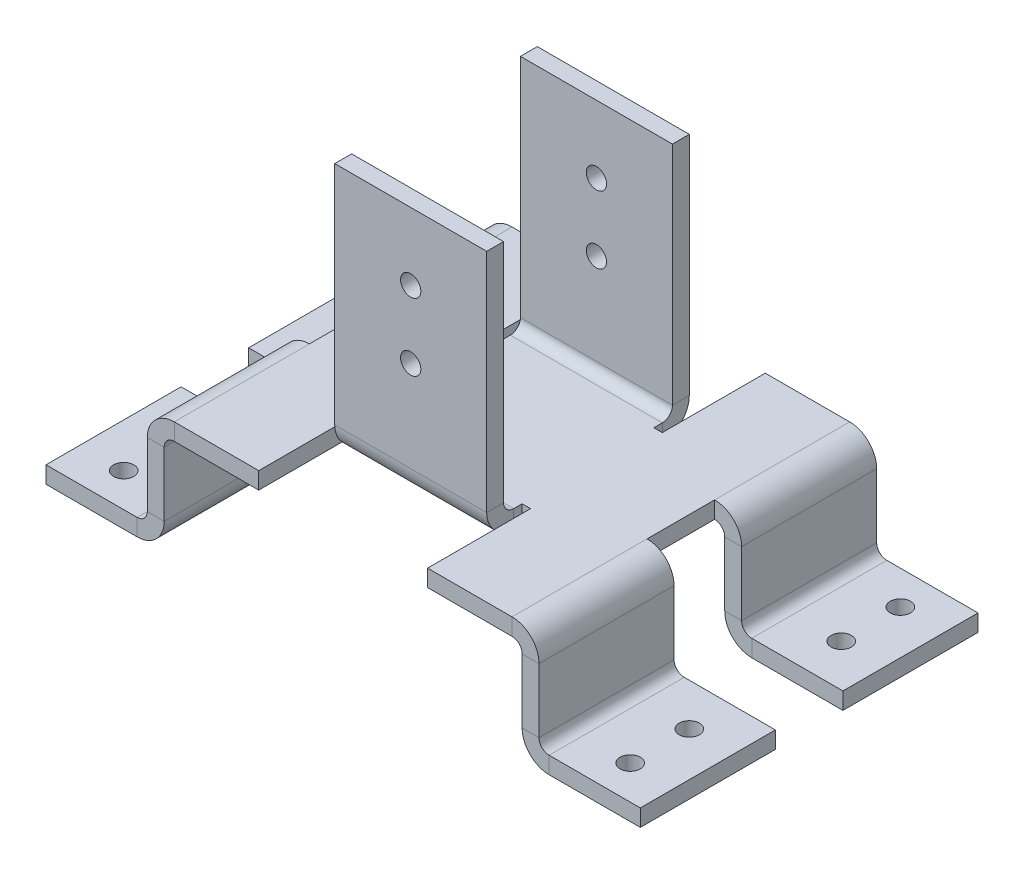
from build123d import *

# Parameters (mm, degrees)
SM_BASE_FLANGE_1_DEPTH            = 5
SM_EDGE_FLANGE_1_STRIP_W          = 26
SM_EDGE_FLANGE_1_STRIP_H          = 5
SM_EDGE_FLANGE_1_STRIP_CUT_DEPTH  = 45
SM_EDGE_FLANGE_1_RELIEF_W         = 28.5
SM_EDGE_FLANGE_1_RELIEF_H         = 2.5
SM_EDGE_FLANGE_1_RELIEF_CUT_DEPTH = 5
SM_EDGE_FLANGE_1_DEPTH            = 45
SM_EDGE_FLANGE_2_STRIP_W          = 26
SM_EDGE_FLANGE_2_STRIP_H          = 5
SM_EDGE_FLANGE_2_STRIP_CUT_DEPTH  = 45
SM_EDGE_FLANGE_2_RELIEF_W         = 28.5
SM_EDGE_FLANGE_2_RELIEF_H         = 2.5
SM_EDGE_FLANGE_2_RELIEF_CUT_DEPTH = 5
SM_EDGE_FLANGE_2_DEPTH            = 45
SM_EDGE_FLANGE_14_DEPTH           = 40
SM_EDGE_FLANGE_15_DEPTH           = 40
SM_EDGE_FLANGE_16_DEPTH           = 40
SM_EDGE_FLANGE_17_DEPTH           = 40
SM_EDGE_FLANGE_18_STRIP_W         = 26
SM_EDGE_FLANGE_18_STRIP_H         = 5
SM_EDGE_FLANGE_18_STRIP_CUT_DEPTH = 40
SM_EDGE_FLANGE_18_DEPTH           = 40
SM_EDGE_FLANGE_19_STRIP_W         = 26
SM_EDGE_FLANGE_19_STRIP_H         = 5
SM_EDGE_FLANGE_19_STRIP_CUT_DEPTH = 40
SM_EDGE_FLANGE_19_DEPTH           = 40
SM_EDGE_FLANGE_20_STRIP_W         = 26
SM_EDGE_FLANGE_20_STRIP_H         = 5
SM_EDGE_FLANGE_20_STRIP_CUT_DEPTH = 40
SM_EDGE_FLANGE_20_DEPTH           = 40
SM_EDGE_FLANGE_21_STRIP_W         = 26
SM_EDGE_FLANGE_21_STRIP_H         = 5
SM_EDGE_FLANGE_21_STRIP_CUT_DEPTH = 40
SM_EDGE_FLANGE_21_DEPTH           = 40
CUT_EXTRUDE_START                 = -35
SKETCH_80_R                       = 3
CUT_EXTRUDE_1_DEPTH               = 5
CUT_EXTRUDE_3_DEPTH               = 124.060960503
CUT_EXTRUDE_3_DEPTH_BACK          = 124.060960503
SKETCH_83_R                       = 3
CUT_EXTRUDE_START_2               = -30
SKETCH_84_R                       = 3
CUT_EXTRUDE_5_DEPTH               = 5


# Sheet-metal steps are written as plain solids
with BuildPart() as part:
    # Sketch 1 → 基体-法兰1 (new body)
    with BuildSketch(Plane(origin=(0, 0, 0), x_dir=(1, 0, 0), z_dir=(0, 1, 0))):
        Polygon((-25, -25), (-25, -50), (-50, -50), (-50, 50), (-25, 50), (-25, 25), (25, 25), (25, 50), (50, 50), (50, -50), (25, -50), (25, -25), align=None)
    extrude(amount=-SM_BASE_FLANGE_1_DEPTH)

    # 边线-法兰1 strip (across the edge) → 边线-法兰1 strip cut (cut)
    with BuildSketch(Plane(origin=(22.5, 0, -25), x_dir=(0, 0, 1), z_dir=(-1, 0, 0))):
        with Locations((-10, -2.5)):
            Rectangle(SM_EDGE_FLANGE_1_STRIP_W, SM_EDGE_FLANGE_1_STRIP_H)
    extrude(amount=SM_EDGE_FLANGE_1_STRIP_CUT_DEPTH, mode=Mode.SUBTRACT)

    # 边线-法兰1 relief (on the sheet) → 边线-法兰1 relief cut (cut)
    with BuildSketch(Plane(origin=(22.5, 0, -22), x_dir=(0, 0, 1), z_dir=(0, 1, 0))):
        with Locations((-11.75, 1.25)):
            Rectangle(SM_EDGE_FLANGE_1_RELIEF_W, SM_EDGE_FLANGE_1_RELIEF_H)
        with Locations((-11.75, -46.25)):
            Rectangle(SM_EDGE_FLANGE_1_RELIEF_W, SM_EDGE_FLANGE_1_RELIEF_H)
    extrude(amount=-SM_EDGE_FLANGE_1_RELIEF_CUT_DEPTH, mode=Mode.SUBTRACT)

    # 边线-法兰1 section (across the edge) → 边线-法兰1 (add)
    with BuildSketch(Plane(origin=(22.5, 0, -25), x_dir=(0, 0, 1), z_dir=(-1, 0, 0))):
        with BuildLine():
            Line((-5, 3), (-5, 70))
            Line((-5, 70), (0, 70))
            Line((0, 70), (0, 3))
            ThreePointArc((0, 3), (0.878679656, 0.878679656), (3, 0))
            Line((3, 0), (3, -5))
            ThreePointArc((3, -5), (-2.656854249, -2.656854249), (-5, 3))
        make_face()
    extrude(amount=SM_EDGE_FLANGE_1_DEPTH)

    # 边线-法兰2 strip (across the edge) → 边线-法兰2 strip cut (cut)
    with BuildSketch(Plane(origin=(-22.5, 0, 25), x_dir=(0, 0, -1), z_dir=(1, 0, 0))):
        with Locations((-10, -2.5)):
            Rectangle(SM_EDGE_FLANGE_2_STRIP_W, SM_EDGE_FLANGE_2_STRIP_H)
    extrude(amount=SM_EDGE_FLANGE_2_STRIP_CUT_DEPTH, mode=Mode.SUBTRACT)

    # 边线-法兰2 relief (on the sheet) → 边线-法兰2 relief cut (cut)
    with BuildSketch(Plane(origin=(-22.5, 0, 22), x_dir=(0, 0, -1), z_dir=(0, 1, 0))):
        with Locations((-11.75, 1.25)):
            Rectangle(SM_EDGE_FLANGE_2_RELIEF_W, SM_EDGE_FLANGE_2_RELIEF_H)
        with Locations((-11.75, -46.25)):
            Rectangle(SM_EDGE_FLANGE_2_RELIEF_W, SM_EDGE_FLANGE_2_RELIEF_H)
    extrude(amount=-SM_EDGE_FLANGE_2_RELIEF_CUT_DEPTH, mode=Mode.SUBTRACT)

    # 边线-法兰2 section (across the edge) → 边线-法兰2 (add)
    with BuildSketch(Plane(origin=(-22.5, 0, 25), x_dir=(0, 0, -1), z_dir=(1, 0, 0))):
        with BuildLine():
            Line((-5, 3), (-5, 70))
            Line((-5, 70), (0, 70))
            Line((0, 70), (0, 3))
            ThreePointArc((0, 3), (0.878679656, 0.878679656), (3, 0))
            Line((3, 0), (3, -5))
            ThreePointArc((3, -5), (-2.656854249, -2.656854249), (-5, 3))
        make_face()
    extrude(amount=SM_EDGE_FLANGE_2_DEPTH)

    # 边线-法兰14 section (across the edge) → 边线-法兰14 (add)
    with BuildSketch(Plane(origin=(53, -5, 10), x_dir=(-1, 0, 0), z_dir=(0, 0, 1))):
        with BuildLine():
            Line((-5, 3), (-5, 30))
            Line((-5, 30), (0, 30))
            Line((0, 30), (0, 3))
            ThreePointArc((0, 3), (0.878679656, 0.878679656), (3, 0))
            Line((3, 0), (3, -5))
            ThreePointArc((3, -5), (-2.656854249, -2.656854249), (-5, 3))
        make_face()
    extrude(amount=SM_EDGE_FLANGE_14_DEPTH)

    # 边线-法兰15 section (across the edge) → 边线-法兰15 (add)
    with BuildSketch(Plane(origin=(53, -5, -50), x_dir=(-1, 0, 0), z_dir=(0, 0, 1))):
        with BuildLine():
            Line((-5, 3), (-5, 30))
            Line((-5, 30), (0, 30))
            Line((0, 30), (0, 3))
            ThreePointArc((0, 3), (0.878679656, 0.878679656), (3, 0))
            Line((3, 0), (3, -5))
            ThreePointArc((3, -5), (-2.656854249, -2.656854249), (-5, 3))
        make_face()
    extrude(amount=SM_EDGE_FLANGE_15_DEPTH)

    # 边线-法兰16 section (across the edge) → 边线-法兰16 (add)
    with BuildSketch(Plane(origin=(-53, -5, -10), x_dir=(1, 0, 0), z_dir=(0, 0, -1))):
        with BuildLine():
            Line((-5, 3), (-5, 30))
            Line((-5, 30), (0, 30))
            Line((0, 30), (0, 3))
            ThreePointArc((0, 3), (0.878679656, 0.878679656), (3, 0))
            Line((3, 0), (3, -5))
            ThreePointArc((3, -5), (-2.656854249, -2.656854249), (-5, 3))
        make_face()
    extrude(amount=SM_EDGE_FLANGE_16_DEPTH)

    # 边线-法兰17 section (across the edge) → 边线-法兰17 (add)
    with BuildSketch(Plane(origin=(-53, -5, 50), x_dir=(1, 0, 0), z_dir=(0, 0, -1))):
        with BuildLine():
            Line((-5, 3), (-5, 30))
            Line((-5, 30), (0, 30))
            Line((0, 30), (0, 3))
            ThreePointArc((0, 3), (0.878679656, 0.878679656), (3, 0))
            Line((3, 0), (3, -5))
            ThreePointArc((3, -5), (-2.656854249, -2.656854249), (-5, 3))
        make_face()
    extrude(amount=SM_EDGE_FLANGE_17_DEPTH)

    # 边线-法兰18 strip (across the edge) → 边线-法兰18 strip cut (cut)
    with BuildSketch(Plane(origin=(-58, -35, -50), x_dir=(0, 1, 0), z_dir=(0, 0, 1))):
        with Locations((-5, -2.5)):
            Rectangle(SM_EDGE_FLANGE_18_STRIP_W, SM_EDGE_FLANGE_18_STRIP_H)
    extrude(amount=SM_EDGE_FLANGE_18_STRIP_CUT_DEPTH, mode=Mode.SUBTRACT)

    # 边线-法兰18 section (across the edge) → 边线-法兰18 (add)
    with BuildSketch(Plane(origin=(-58, -35, -50), x_dir=(0, 1, 0), z_dir=(0, 0, 1))):
        with BuildLine():
            Line((0, 3), (0, 30))
            Line((0, 30), (5, 30))
            Line((5, 30), (5, 3))
            ThreePointArc((5, 3), (5.878679656, 0.878679656), (8, 0))
            Line((8, 0), (8, -5))
            ThreePointArc((8, -5), (2.343145751, -2.656854249), (0, 3))
        make_face()
    extrude(amount=SM_EDGE_FLANGE_18_DEPTH)

    # 边线-法兰19 strip (across the edge) → 边线-法兰19 strip cut (cut)
    with BuildSketch(Plane(origin=(-58, -35, 10), x_dir=(0, 1, 0), z_dir=(0, 0, 1))):
        with Locations((-5, -2.5)):
            Rectangle(SM_EDGE_FLANGE_19_STRIP_W, SM_EDGE_FLANGE_19_STRIP_H)
    extrude(amount=SM_EDGE_FLANGE_19_STRIP_CUT_DEPTH, mode=Mode.SUBTRACT)

    # 边线-法兰19 section (across the edge) → 边线-法兰19 (add)
    with BuildSketch(Plane(origin=(-58, -35, 10), x_dir=(0, 1, 0), z_dir=(0, 0, 1))):
        with BuildLine():
            Line((0, 3), (0, 30))
            Line((0, 30), (5, 30))
            Line((5, 30), (5, 3))
            ThreePointArc((5, 3), (5.878679656, 0.878679656), (8, 0))
            Line((8, 0), (8, -5))
            ThreePointArc((8, -5), (2.343145751, -2.656854249), (0, 3))
        make_face()
    extrude(amount=SM_EDGE_FLANGE_19_DEPTH)

    # 边线-法兰20 strip (across the edge) → 边线-法兰20 strip cut (cut)
    with BuildSketch(Plane(origin=(58, -35, 50), x_dir=(0, 1, 0), z_dir=(0, 0, -1))):
        with Locations((-5, -2.5)):
            Rectangle(SM_EDGE_FLANGE_20_STRIP_W, SM_EDGE_FLANGE_20_STRIP_H)
    extrude(amount=SM_EDGE_FLANGE_20_STRIP_CUT_DEPTH, mode=Mode.SUBTRACT)

    # 边线-法兰20 section (across the edge) → 边线-法兰20 (add)
    with BuildSketch(Plane(origin=(58, -35, 50), x_dir=(0, 1, 0), z_dir=(0, 0, -1))):
        with BuildLine():
            Line((0, 3), (0, 30))
            Line((0, 30), (5, 30))
            Line((5, 30), (5, 3))
            ThreePointArc((5, 3), (5.878679656, 0.878679656), (8, 0))
            Line((8, 0), (8, -5))
            ThreePointArc((8, -5), (2.343145751, -2.656854249), (0, 3))
        make_face()
    extrude(amount=SM_EDGE_FLANGE_20_DEPTH)

    # 边线-法兰21 strip (across the edge) → 边线-法兰21 strip cut (cut)
    with BuildSketch(Plane(origin=(58, -35, -10), x_dir=(0, 1, 0), z_dir=(0, 0, -1))):
        with Locations((-5, -2.5)):
            Rectangle(SM_EDGE_FLANGE_21_STRIP_W, SM_EDGE_FLANGE_21_STRIP_H)
    extrude(amount=SM_EDGE_FLANGE_21_STRIP_CUT_DEPTH, mode=Mode.SUBTRACT)

    # 边线-法兰21 section (across the edge) → 边线-法兰21 (add)
    with BuildSketch(Plane(origin=(58, -35, -10), x_dir=(0, 1, 0), z_dir=(0, 0, -1))):
        with BuildLine():
            Line((0, 3), (0, 30))
            Line((0, 30), (5, 30))
            Line((5, 30), (5, 3))
            ThreePointArc((5, 3), (5.878679656, 0.878679656), (8, 0))
            Line((8, 0), (8, -5))
            ThreePointArc((8, -5), (2.343145751, -2.656854249), (0, 3))
        make_face()
    extrude(amount=SM_EDGE_FLANGE_21_DEPTH)

    # 草图80 → 切除-拉伸1 (cut)
    with BuildSketch(Plane(origin=(0, 0, 0), x_dir=(1, 0, 0), z_dir=(0, 1, 0)).offset(CUT_EXTRUDE_START)):
        with Locations(Location((-75, 40, 0), (0, 0, 270))):
            Circle(SKETCH_80_R)
        with Locations(Location((75, 40, 0), (0, 0, 270))):
            Circle(SKETCH_80_R)
        with Locations(Location((-75, -40, 0), (0, 0, 270))):
            Circle(SKETCH_80_R)
        with Locations(Location((75, -40, 0), (0, 0, 270))):
            Circle(SKETCH_80_R)
    extrude(amount=CUT_EXTRUDE_1_DEPTH, mode=Mode.SUBTRACT)

    # 草图83 → 切除-拉伸3 (cut, two sides: drawn at the far end of the back side and taken through both)
    with BuildSketch(Plane.XY.offset(-CUT_EXTRUDE_3_DEPTH_BACK)):
        with Locations((0, 50)):
            Circle(SKETCH_83_R)
        with Locations((0, 30)):
            Circle(SKETCH_83_R)
    extrude(amount=CUT_EXTRUDE_3_DEPTH + CUT_EXTRUDE_3_DEPTH_BACK, mode=Mode.SUBTRACT)

    # 草图84 → 切除-拉伸5 (cut)
    with BuildSketch(Plane(origin=(0, 0, 0), x_dir=(1, 0, 0), z_dir=(0, 1, 0)).offset(CUT_EXTRUDE_START_2)):
        with Locations(Location((75, 22.5, 0), (0, 0, 270))):
            Circle(SKETCH_84_R)
        with Locations(Location((75, -22.5, 0), (0, 0, 270))):
            Circle(SKETCH_84_R)
        with Locations(Location((-75, -22.5, 0), (0, 0, 270))):
            Circle(SKETCH_84_R)
        with Locations(Location((-75, 22.5, 0), (0, 0, 270))):
            Circle(SKETCH_84_R)
    extrude(amount=-CUT_EXTRUDE_5_DEPTH, mode=Mode.SUBTRACT)


solid = part.part
